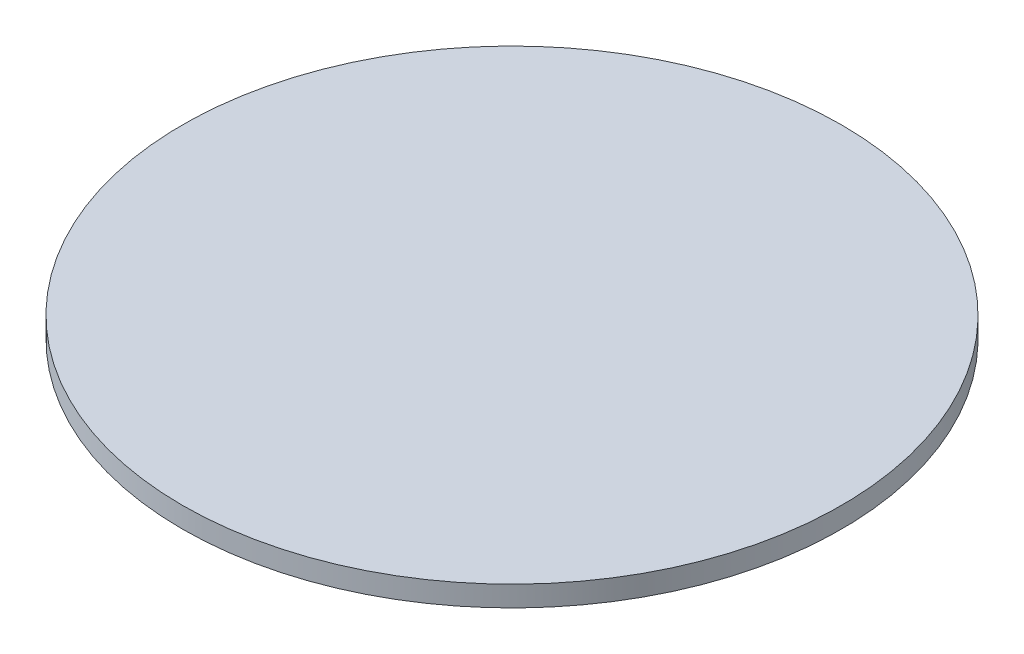
from build123d import *

# Parameters (mm, degrees)
SKETCH1_R           = 101.6
BOSS_EXTRUDE1_DEPTH = 6.35


with BuildPart() as part:
    # Sketch1 → Boss-Extrude1 (new body)
    with BuildSketch(Plane(origin=(0, 0, 0), x_dir=(1, 0, 0), z_dir=(0, 1, 0))):
        Circle(SKETCH1_R)
    extrude(amount=-BOSS_EXTRUDE1_DEPTH)


solid = part.part
